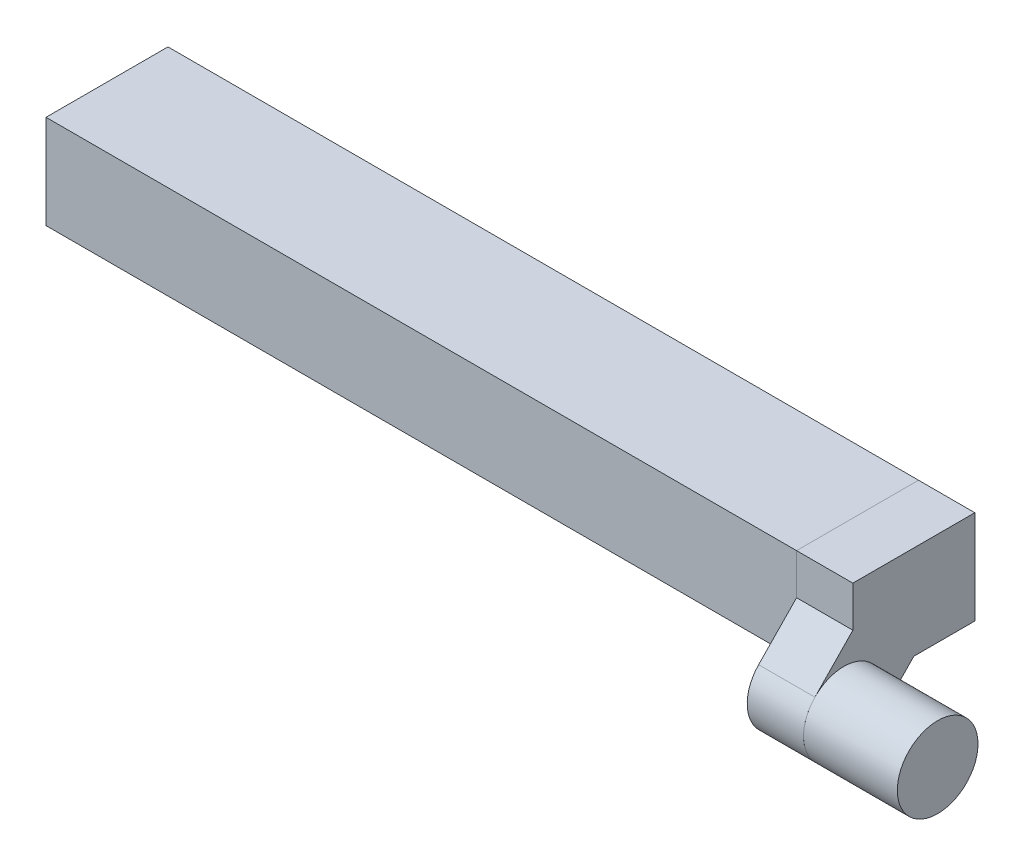
from build123d import *

# Parameters (mm, degrees)
SKETCH2_W           = 6.5
SKETCH2_H           = 5
SKETCH2_W_2         = 4.1
SKETCH2_H_2         = 4.1
BOSS_EXTRUDE1_DEPTH = 10
BOSS_EXTRUDE2_START = 15
SKETCH2_2_W         = 6.5
SKETCH2_2_H         = 5
BOSS_EXTRUDE2_DEPTH = 25
BOSS_EXTRUDE3_DEPTH = 3
SKETCH6_R           = 2.15
BOSS_EXTRUDE4_DEPTH = 5
BOSS_EXTRUDE5_START = 10
SKETCH2_4_W         = 6.5
SKETCH2_4_H         = 5
SKETCH2_4_W_2       = 4.1
SKETCH2_4_H_2       = 4.1
BOSS_EXTRUDE5_DEPTH = 5


with BuildPart() as part:
    # Sketch2 → Boss-Extrude1 (new body)
    with BuildSketch(Plane(origin=(0, 0, 0), x_dir=(0, 0, -1), z_dir=(1, 0, 0))):
        Rectangle(SKETCH2_W, SKETCH2_H)
        Rectangle(SKETCH2_W_2, SKETCH2_H_2, mode=Mode.SUBTRACT)
    extrude(amount=BOSS_EXTRUDE1_DEPTH)



with BuildPart() as body_2:
    # Sketch2<2> → Boss-Extrude2 (new body)
    with BuildSketch(Plane(origin=(0, 0, 0), x_dir=(0, 0, -1), z_dir=(1, 0, 0)).offset(BOSS_EXTRUDE2_START)):
        Rectangle(SKETCH2_2_W, SKETCH2_2_H)
    extrude(amount=BOSS_EXTRUDE2_DEPTH)


with BuildPart() as body_3:
    # Sketch5 → Boss-Extrude3 (new body)
    with BuildSketch(Plane(origin=(40, 0, 0), x_dir=(0, 0, -1), z_dir=(1, 0, 0))):
        with BuildLine():
            Line((-3.25, 2.5), (3.25, 2.5))
            Line((3.25, 2.5), (3.25, -2.5))
            Line((3.25, -2.5), (0, -2.5))
            Line((0, -2.5), (-2.189003993, -4.751662813))
            ThreePointArc((-2.189003993, -4.751662813), (-5.229260512, -4.794561524), (-5.272159224, -1.754305005))
            Line((-5.272159224, -1.754305005), (-3.25, 0.325737214))
            Line((-3.25, 0.325737214), (-3.25, 2.5))
        make_face()
    extrude(amount=BOSS_EXTRUDE3_DEPTH)


with BuildPart() as body_4:
    # Sketch6 → Boss-Extrude4 (new body)
    with BuildSketch(Plane(origin=(43, 0, 0), x_dir=(0, 0, -1), z_dir=(1, 0, 0))):
        with Locations((-3.730581608, -3.252983909)):
            Circle(SKETCH6_R)
    extrude(amount=BOSS_EXTRUDE4_DEPTH)


with BuildPart() as part_1:
    add(part.part)

    add(body_2.part)  # Boss-Extrude5 merges body 2
    # Sketch2<4> → Boss-Extrude5 (add)
    with BuildSketch(Plane(origin=(0, 0, 0), x_dir=(0, 0, -1), z_dir=(1, 0, 0)).offset(BOSS_EXTRUDE5_START)):
        Rectangle(SKETCH2_4_W, SKETCH2_4_H)
        Rectangle(SKETCH2_4_W_2, SKETCH2_4_H_2, mode=Mode.SUBTRACT)
    extrude(amount=BOSS_EXTRUDE5_DEPTH)


solid = Compound([body_3.part, body_4.part, part_1.part])
